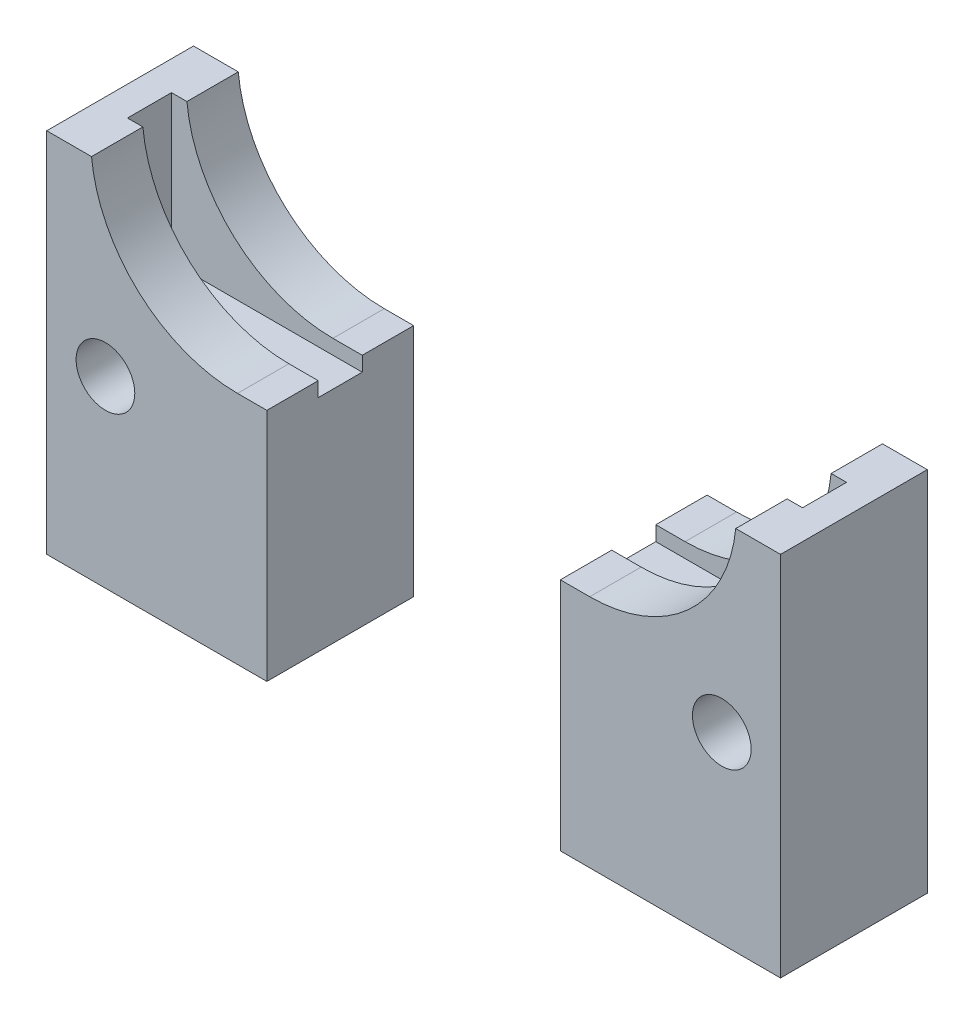
from build123d import *

# Parameters (mm, degrees)
SKETCH1_W           = 50
SKETCH1_H           = 10
BOSS_EXTRUDE1_DEPTH = 15
SKETCH3_W           = 46
SKETCH3_H           = 3
CUT_EXTRUDE1_DEPTH  = 10
CUT_EXTRUDE2_DEPTH  = 10
SKETCH5_W           = 15
SKETCH5_H           = 10
BOSS_EXTRUDE2_DEPTH = 10
SKETCH6_R           = 2
CUT_EXTRUDE3_DEPTH  = 31.822070015


with BuildPart() as part:
    # Sketch1 → Boss-Extrude1 (new body)
    with BuildSketch(Plane(origin=(0, 0, 0), x_dir=(1, 0, 0), z_dir=(0, 1, 0))):
        Rectangle(SKETCH1_W, SKETCH1_H)
    extrude(amount=BOSS_EXTRUDE1_DEPTH)

    # Sketch3 → Cut-Extrude1 (cut)
    with BuildSketch(Plane(origin=(0, 15, 0), x_dir=(1, 0, 0), z_dir=(0, 1, 0))):
        Rectangle(SKETCH3_W, SKETCH3_H)
    extrude(amount=-CUT_EXTRUDE1_DEPTH, mode=Mode.SUBTRACT)

    # Sketch4 → Cut-Extrude2 (cut)
    with BuildSketch(Plane.XY.offset(5)):
        with BuildLine():
            Line((-10, 6), (-10, 0))
            Line((-10, 0), (10, 0))
            Line((10, 0), (10, 6))
            Line((10, 6), (12, 6))
            ThreePointArc((12, 6), (18.708203932, 8.583801513), (21.949874371, 15))
            Line((21.949874371, 15), (-21.949874371, 15))
            ThreePointArc((-21.949874371, 15), (-18.708203932, 8.583801513), (-12, 6))
            Line((-12, 6), (-10, 6))
        make_face()
    extrude(amount=-CUT_EXTRUDE2_DEPTH, mode=Mode.SUBTRACT)


with BuildPart() as cut_extrude2_piece_1:
    # of the separate pieces the step leaves, piece 1, a body of its own (cut_extrude2_pieces)
    add(part.part.solids().sort_by_distance((-25, 0, 5))[0])



with BuildPart() as cut_extrude2_piece_2:
    # of the separate pieces the step leaves, piece 2, a body of its own (cut_extrude2_pieces)
    add(part.part.solids().sort_by_distance((10, 0, 5))[0])


with BuildPart() as cut_extrude2_piece_1_1:
    add(cut_extrude2_piece_1.part)

    add(cut_extrude2_piece_2.part)  # Boss-Extrude2 merges Cut-Extrude2 piece 2
    # Sketch5 → Boss-Extrude2 (add)
    with BuildSketch(Plane.XZ):
        with Locations((-17.5, 0)):
            Rectangle(SKETCH5_W, SKETCH5_H)
        with Locations((17.5, 0)):
            Rectangle(SKETCH5_W, SKETCH5_H)
    extrude(amount=BOSS_EXTRUDE2_DEPTH)

    # Sketch6 → Cut-Extrude3 (cut, through all)
    with BuildSketch(Plane.XY.offset(5)):
        with Locations((-21, 2.5)):
            Circle(SKETCH6_R)
        with Locations((21, 2.5)):
            Circle(SKETCH6_R)
    extrude(amount=-CUT_EXTRUDE3_DEPTH, mode=Mode.SUBTRACT)


solid = cut_extrude2_piece_1_1.part
